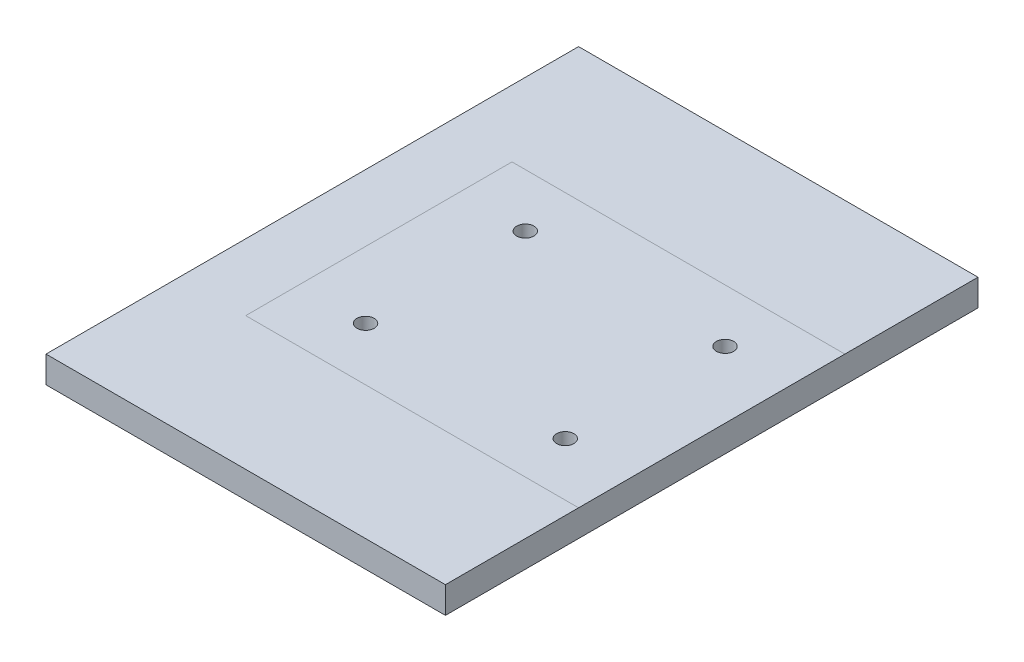
from build123d import *

# Parameters (mm, degrees)
SKETCH1_W           = 300
SKETCH1_H           = 400
SUPPORT_PLATE_DEPTH = 20
SKETCH2_R           = 6.5
BOLT_HOLES_DEPTH    = 251.79872408


with BuildPart() as part:
    # Sketch1 → Support Plate (new body)
    with BuildSketch(Plane(origin=(0, 0, 0), x_dir=(1, 0, 0), z_dir=(0, 1, 0))):
        Rectangle(SKETCH1_W, SKETCH1_H)
    extrude(amount=-SUPPORT_PLATE_DEPTH)

    # Sketch2 → Bolt Holes (cut, through all)
    with BuildSketch(Plane(origin=(0, 0, 0), x_dir=(-1, 0, 0), z_dir=(0, 1, 0))):
        with Locations((-100, -60)):
            Circle(SKETCH2_R)
        with Locations((50, -60)):
            Circle(SKETCH2_R)
        with Locations((50, 60)):
            Circle(SKETCH2_R)
        with Locations((-100, 60)):
            Circle(SKETCH2_R)
    extrude(amount=-BOLT_HOLES_DEPTH, mode=Mode.SUBTRACT)


solid = part.part
